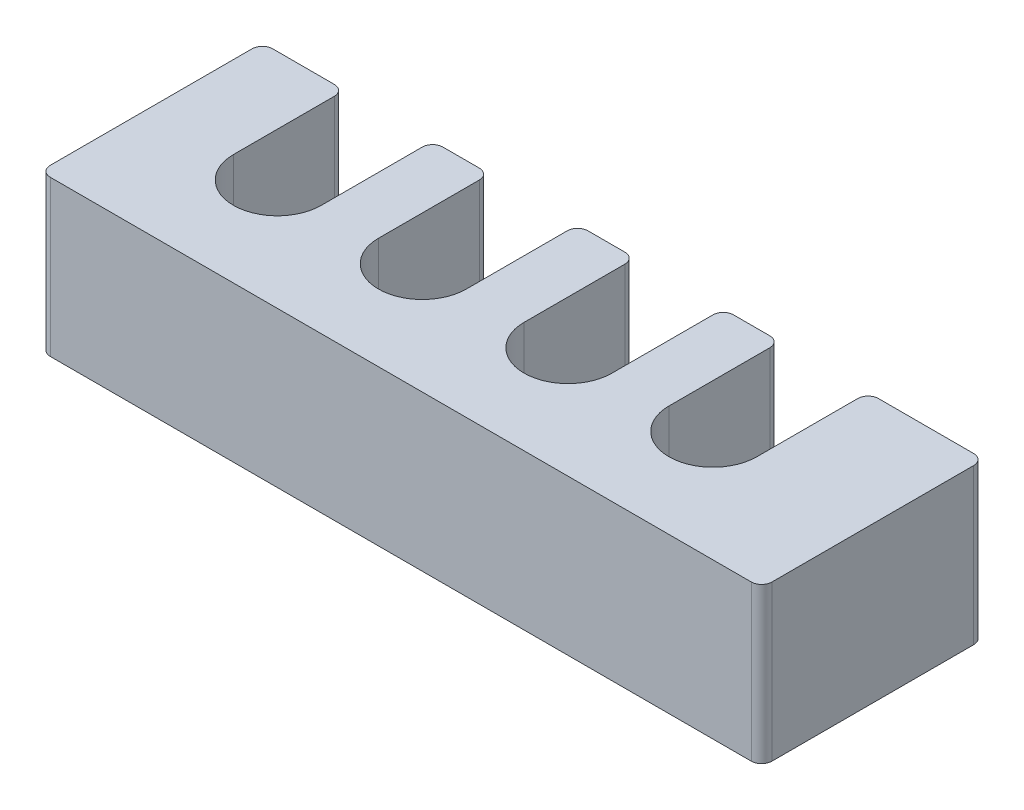
from build123d import *

# Parameters (mm, degrees)
SKIZZE1_W                        = 139.5
SKIZZE1_H                        = 58
AUFSATZ_LINEAR_AUSTRAGEN1_DEPTH  = 28
SCHNITT_LINEAR_AUSTRAGEN2_DEPTH  = 30
VERRUNDUNG1_R                    = 8.5
SKIZZE5_W                        = 7.28
SKIZZE5_H                        = 30
SKIZZE5_W_2                      = 4
SKIZZE5_W_3                      = 4.15
SKIZZE5_W_4                      = 13.92
AUFSATZ_LINEAR_AUSTRAGEN2_DEPTH  = 4
VERRUNDUNG2_R                    = 5
AUFSATZ_LINEAR_AUSTRAGEN3_DEPTH  = 2
VERRUNDUNG3_R                    = 2
VERRUNDUNG4_R                    = 2
SKIZZE7_W                        = 139.5
SKIZZE7_H                        = 15
SCHNITT_LINEAR_AUSTRAGEN5_DEPTH  = 155.026783385
VERRUNDUNG5_R                    = 2
M2_5_GEWINDEBOHRUNG1_D           = 2.05
M2_5_GEWINDEBOHRUNG1_DEPTH       = 4.25
M2_5_GEWINDEBOHRUNG1_CSINK_D     = 2.55
M2_5_GEWINDEBOHRUNG1_CSINK_ANGLE = 90
M2_5_GEWINDEBOHRUNG1_TIP         = 0.615882135


with BuildPart() as part:
    # Skizze1 → Aufsatz-Linear austragen1 (new body)
    with BuildSketch(Plane(origin=(0, 0, 0), x_dir=(1, 0, 0), z_dir=(0, 1, 0))):
        with Locations((69.75, 29)):
            Rectangle(SKIZZE1_W, SKIZZE1_H)
    extrude(amount=AUFSATZ_LINEAR_AUSTRAGEN1_DEPTH)

    # Skizze4 → Schnitt-Linear austragen2 (cut)
    with BuildSketch(Plane(origin=(0, 0, -58), x_dir=(-1, 0, 0), z_dir=(0, 0, -1))):
        Polygon((-3.63, 0), (-80.58, 0), (-134.5, 0), (-134.5, 4), (-117.08, 4), (-117.08, 28), (-108.58, 28), (-100.08, 28), (-100.08, 4), (-89.08, 4), (-89.08, 28), (-72.08, 28), (-72.08, 4), (-60.93, 4), (-60.93, 28), (-43.93, 28), (-43.93, 4), (-32.9, 4), (-32.9, 28), (-15.9, 28), (-15.9, 4), (-5, 4), (-5, 0), align=None)
    extrude(amount=-SCHNITT_LINEAR_AUSTRAGEN2_DEPTH, mode=Mode.SUBTRACT)

    # Verrundung1
    verrundung1_edges = [part.edges().sort_by_distance(p)[0] for p in [
        (15.9, 16, -28),
        (32.9, 16, -28),
        (43.93, 16, -28),
        (60.93, 16, -28),
        (72.08, 16, -28),
        (89.08, 16, -28),
        (100.08, 16, -28),
        (117.08, 16, -28),
    ]]
    fillet(verrundung1_edges, radius=VERRUNDUNG1_R - 0.0001)  # a hair under: the kernel refuses the full size

    # Skizze5 → Aufsatz-Linear austragen2 (add)
    with BuildSketch(Plane.XZ.offset(-4)):
        with Locations((8.64, -43)):
            Rectangle(SKIZZE5_W, SKIZZE5_H)
        with Locations((94.58, -43)):
            Rectangle(SKIZZE5_W_2, SKIZZE5_H)
        with Locations((66.505, -43)):
            Rectangle(SKIZZE5_W_3, SKIZZE5_H)
        with Locations((38.355, -43)):
            Rectangle(SKIZZE5_W_3, SKIZZE5_H)
        with Locations((127.54, -43)):
            Rectangle(SKIZZE5_W_4, SKIZZE5_H)
    extrude(amount=AUFSATZ_LINEAR_AUSTRAGEN2_DEPTH)

    # Verrundung2
    verrundung2_edges = [part.edges().sort_by_distance(p)[0] for p in [
        (12.28, 2, -28),
        (96.58, 2, -28),
        (92.58, 2, -28),
        (68.58, 2, -28),
        (64.43, 2, -28),
        (120.58, 2, -28),
        (40.43, 2, -28),
        (36.28, 2, -28),
    ]]
    fillet(verrundung2_edges, radius=VERRUNDUNG2_R)

    # Skizze6 → Aufsatz-Linear austragen3 (add)
    with BuildSketch(Plane.XZ):
        with BuildLine():
            Line((139.5, -58), (134.5, -58))
            Line((134.5, -58), (134.5, -43))
            Line((134.5, -43), (135.978342998, -40.439434817))
            ThreePointArc((135.978342998, -40.439434817), (136.36732536, -39.500348322), (136.5, -38.492584381))
            Line((136.5, -38.492584381), (136.5, -28))
            ThreePointArc((136.5, -28), (135.035533906, -24.464466094), (131.5, -23))
            Line((131.5, -23), (129.007415619, -23))
            ThreePointArc((129.007415619, -23), (127.999651678, -23.13267464), (127.060565183, -23.521657002))
            Line((127.060565183, -23.521657002), (124.5, -25))
            Line((124.5, -25), (15, -25))
            Line((15, -25), (12.439434817, -23.521657002))
            ThreePointArc((12.439434817, -23.521657002), (11.500348322, -23.13267464), (10.492584381, -23))
            Line((10.492584381, -23), (8, -23))
            ThreePointArc((8, -23), (4.464466094, -24.464466094), (3, -28))
            Line((3, -28), (3, -38.492584381))
            ThreePointArc((3, -38.492584381), (3.13267464, -39.500348322), (3.521657002, -40.439434817))
            Line((3.521657002, -40.439434817), (5, -43))
            Line((5, -43), (5, -58))
            Line((5, -58), (0, -58))
            Line((0, -58), (0, 0))
            Line((0, 0), (139.5, 0))
            Line((139.5, 0), (139.5, -58))
        make_face()
    extrude(amount=AUFSATZ_LINEAR_AUSTRAGEN3_DEPTH)

    # Verrundung3
    verrundung3_edges = [part.edges().sort_by_distance(p)[0] for p in [
        (117.08, 16, -58),
        (100.08, 16, -58),
        (72.08, 16, -58),
        (43.93, 16, -58),
        (15.9, 16, -58),
        (32.9, 16, -58),
        (60.93, 16, -58),
        (89.08, 16, -58),
        (0, 13, -58),
        (139.5, 13, -58),
        (139.5, 13, 0),
        (0, 13, 0),
    ]]
    fillet(verrundung3_edges, radius=VERRUNDUNG3_R)

    # Verrundung4
    verrundung4_edges = [part.edges().sort_by_distance(p)[0] for p in [
        (12.28, 2, -58),
        (96.58, 2, -58),
        (92.58, 2, -58),
        (68.58, 2, -58),
        (64.43, 2, -58),
        (120.58, 2, -58),
        (40.43, 2, -58),
        (36.28, 2, -58),
        (5, -1, -58),
        (134.5, -1, -58),
    ]]
    fillet(verrundung4_edges, radius=VERRUNDUNG4_R - 0.0001)  # a hair under: the kernel refuses the full size

    # Skizze7 → Schnitt-Linear austragen5 (cut, through all)
    with BuildSketch(Plane(origin=(0, 28, 0), x_dir=(1, 0, 0), z_dir=(0, 1, 0))):
        with Locations((69.75, 7.5)):
            Rectangle(SKIZZE7_W, SKIZZE7_H)
    extrude(amount=-SCHNITT_LINEAR_AUSTRAGEN5_DEPTH, mode=Mode.SUBTRACT)

    # Verrundung5
    verrundung5_edges = [part.edges().sort_by_distance(p)[0] for p in [
        (139.5, 13, -15),
        (0, 13, -15),
    ]]
    fillet(verrundung5_edges, radius=VERRUNDUNG5_R)

    # M2.5 Gewindebohrung1
    with Locations(Plane(origin=(0, 0, 0), x_dir=(-1, 0, 0), z_dir=(0, -1, 0))):
        with Locations((-130.75, 32.3), (-8.75, 32.3)):
            CounterSinkHole(M2_5_GEWINDEBOHRUNG1_D / 2, M2_5_GEWINDEBOHRUNG1_CSINK_D / 2, depth=M2_5_GEWINDEBOHRUNG1_DEPTH, counter_sink_angle=M2_5_GEWINDEBOHRUNG1_CSINK_ANGLE)
            with Locations((0, 0, -(M2_5_GEWINDEBOHRUNG1_DEPTH + M2_5_GEWINDEBOHRUNG1_TIP / 2))):  # 118° drill point
                Cone(0, M2_5_GEWINDEBOHRUNG1_D / 2, M2_5_GEWINDEBOHRUNG1_TIP, mode=Mode.SUBTRACT)


solid = part.part
